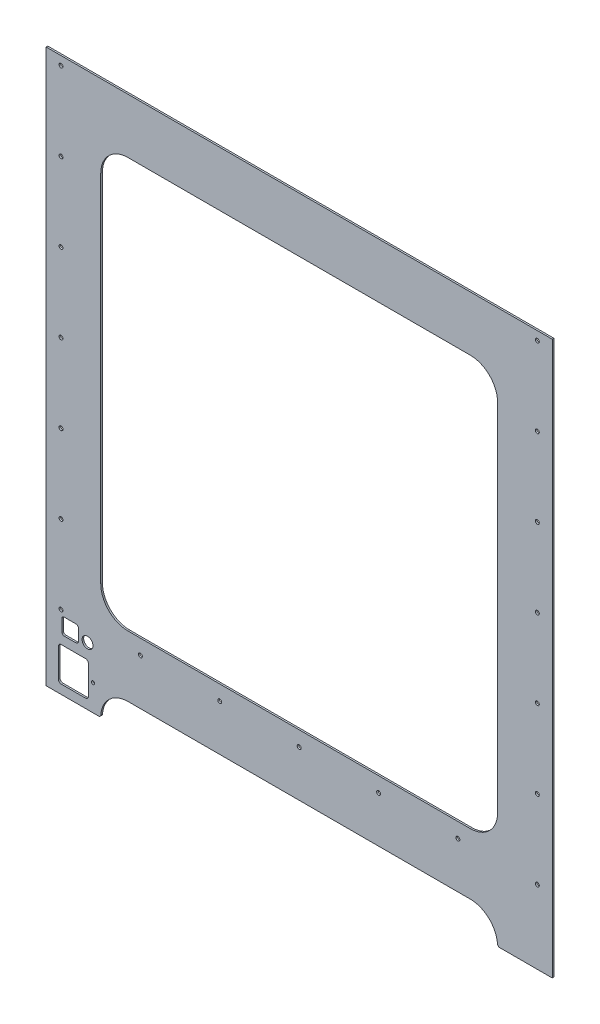
from build123d import *

# Parameters (mm, degrees)
SKETCH2_W                = 463
SKETCH2_H                = 506
BASE_FLANGE1_DEPTH       = 1.51892
SKETCH13_R               = 1.5
SKETCH13_R_2             = 5
CUT_EXTRUDE1_DEPTH       = 1.51892
M3_CLEARANCE_HOLE2_D     = 3.6
M3_CLEARANCE_HOLE2_DEPTH = 11.938
M3_CLEARANCE_HOLE2_TIP   = 1.081549114


# Sheet-metal steps are written as plain solids
with BuildPart() as part:
    # Sketch2 → Base-Flange1 (new body)
    with BuildSketch(Plane.XY):
        with Locations((0, -15.3575)):
            Rectangle(SKETCH2_W, SKETCH2_H)
    extrude(amount=-BASE_FLANGE1_DEPTH)

    # Sketch13 → Cut-Extrude1 (cut)
    with BuildSketch(Plane(origin=(0, 0, -1.51892), x_dir=(-1, 0, 0), z_dir=(0, 0, -1))):
        with BuildLine():
            Line((156.5, 187.5), (-156.5, 187.5))
            ThreePointArc((-156.5, 187.5), (-174.17766953, 180.17766953), (-181.5, 162.5))
            Line((-181.5, 162.5), (-181.5, -162.5))
            ThreePointArc((-181.5, -162.5), (-174.17766953, -180.17766953), (-156.5, -187.5))
            Line((-156.5, -187.5), (156.5, -187.5))
            ThreePointArc((156.5, -187.5), (174.17766953, -180.17766953), (181.5, -162.5))
            Line((181.5, -162.5), (181.5, 162.5))
            ThreePointArc((181.5, 162.5), (174.17766953, 180.17766953), (156.5, 187.5))
        make_face()
        with BuildLine():
            Line((217.65, -260.115), (195.35, -260.115))
            ThreePointArc((195.35, -260.115), (193.582233047, -259.382766953), (192.85, -257.615))
            Line((192.85, -257.615), (192.85, -231.315))
            ThreePointArc((192.85, -231.315), (193.582233047, -229.547233047), (195.35, -228.815))
            Line((195.35, -228.815), (217.65, -228.815))
            ThreePointArc((217.65, -228.815), (219.417766953, -229.547233047), (220.15, -231.315))
            Line((220.15, -231.315), (220.15, -257.615))
            ThreePointArc((220.15, -257.615), (219.417766953, -259.382766953), (217.65, -260.115))
        make_face()
        with BuildLine():
            Line((156.5, -243.3575), (-156.5, -243.3575))
            ThreePointArc((-156.5, -243.3575), (-173.510345436, -250.03679728), (-181.431318552, -266.505648148))
            ThreePointArc((-181.431318552, -266.505648148), (-182.064996401, -267.823156218), (-183.425824036, -268.3575))
            Line((-183.425824036, -268.3575), (183.425824036, -268.3575))
            ThreePointArc((183.425824036, -268.3575), (182.064996401, -267.823156218), (181.431318552, -266.505648148))
            ThreePointArc((181.431318552, -266.505648148), (173.510345436, -250.03679728), (156.5, -243.3575))
        make_face()
        with Locations((188.5, -244.465)):
            Circle(SKETCH13_R)
        with BuildLine():
            Line((217, -207.715), (217, -218.715))
            ThreePointArc((217, -218.715), (216.414213562, -220.129213562), (215, -220.715))
            Line((215, -220.715), (204, -220.715))
            ThreePointArc((204, -220.715), (202.585786438, -220.129213562), (202, -218.715))
            Line((202, -218.715), (202, -207.715))
            ThreePointArc((202, -207.715), (202.585786438, -206.300786438), (204, -205.715))
            Line((204, -205.715), (215, -205.715))
            ThreePointArc((215, -205.715), (216.414213562, -206.300786438), (217, -207.715))
        make_face()
        with Locations((193.6, -215.215)):
            Circle(SKETCH13_R_2)
    extrude(amount=-CUT_EXTRUDE1_DEPTH, mode=Mode.SUBTRACT)

    # M3 Clearance Hole2
    with Locations(Plane.XY):
        with Locations((217.8375, -129.361666667), (217.8375, -57.560833333), (217.8375, 14.24), (217.8375, 86.040833333), (217.8375, 157.841666667), (-217.8375, 157.841666667), (-217.8375, 86.040833333), (-217.8375, 14.24), (-217.8375, -57.560833333), (-217.8375, -129.361666667), (-145.225, -201.1625), (-72.6125, -201.1625), (0, -201.1625), (72.6125, -201.1625), (145.225, -201.1625), (-217.8375, 229.6425), (217.8375, 229.6425), (217.8375, -201.1625), (-217.8375, -201.1625)):
            Hole(M3_CLEARANCE_HOLE2_D / 2, depth=M3_CLEARANCE_HOLE2_DEPTH)
            with Locations((0, 0, -(M3_CLEARANCE_HOLE2_DEPTH + M3_CLEARANCE_HOLE2_TIP / 2))):  # 118° drill point
                Cone(0, M3_CLEARANCE_HOLE2_D / 2, M3_CLEARANCE_HOLE2_TIP, mode=Mode.SUBTRACT)


solid = part.part
